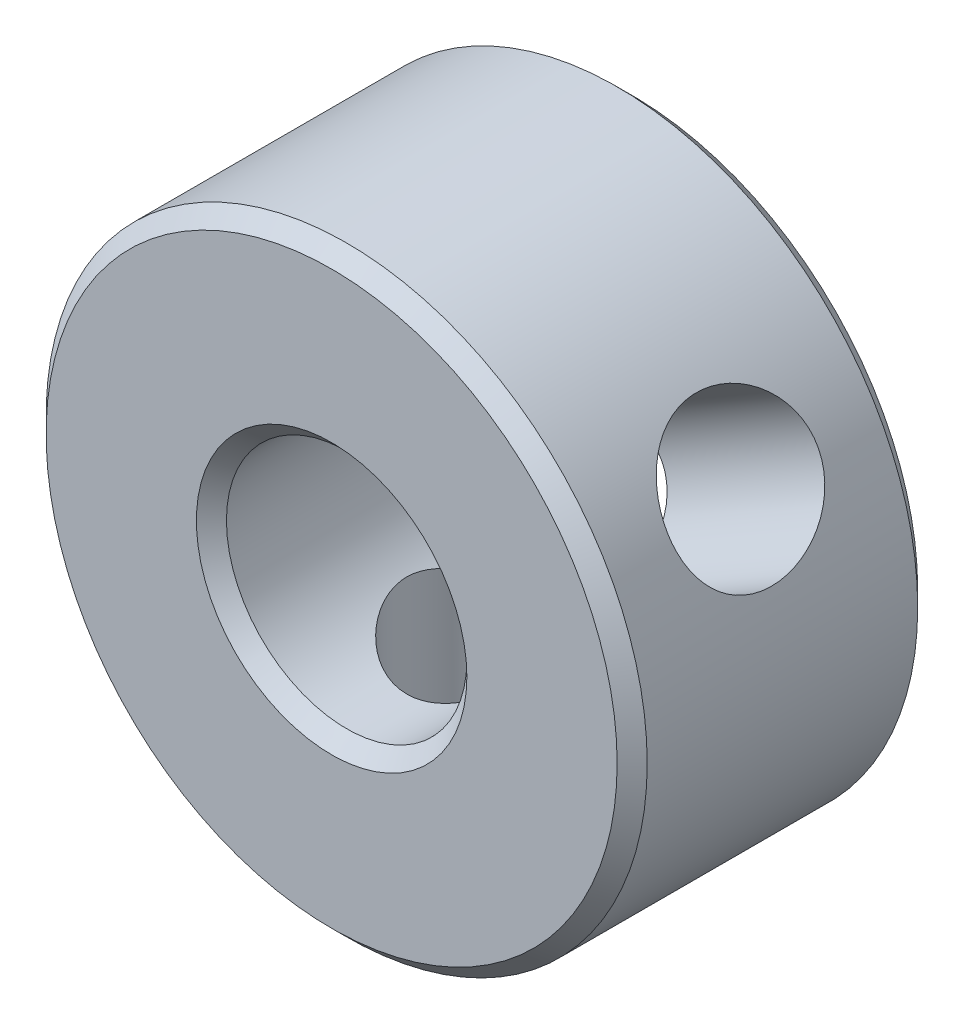
from build123d import *

# Parameters (mm, degrees)
SKETCH1_R          = 10
SKETCH1_R_2        = 4
BASE_EXTRUDE_DEPTH = 10
CHAMFER1_SIZE      = 0.5
SKETCH2_R          = 2.5
HOLE_DEPTH         = 18.320508076
ENDCHAMFER_SIZE    = 0.5
HOLEPAT_COUNT      = 2
HOLEPAT_ANGLE      = 120


with BuildPart() as part:
    # Sketch1 → Base-Extrude (new body)
    with BuildSketch(Plane.XY):
        Circle(SKETCH1_R)
        Circle(SKETCH1_R_2, mode=Mode.SUBTRACT)
    extrude(amount=-BASE_EXTRUDE_DEPTH)

    # Chamfer1
    chamfer1_edges = [part.edges().sort_by_distance(p)[0] for p in [
        (-10, 0, 0),
        (-10, 0, -10),
    ]]
    chamfer(chamfer1_edges, length=CHAMFER1_SIZE)

    # Sketch2 → Hole (cut, through all)
    with BuildSketch(Plane(origin=(0, 0, 0), x_dir=(1, 0, 0), z_dir=(0, 1, 0))):
        with Locations((0, 5)):
            Circle(SKETCH2_R)
    hole = extrude(amount=-HOLE_DEPTH, mode=Mode.SUBTRACT)

    # EndChamfer
    endchamfer_edges = [part.edges().sort_by_distance(p)[0] for p in [
        (-4, 0, -10),
        (-4, 0, 0),
    ]]
    chamfer(endchamfer_edges, length=ENDCHAMFER_SIZE)

    # HolePat: Hole ×2 about axis
    holepat_axis = Axis((0, 0, -10), (0, 0, 1))
    for i in range(1, HOLEPAT_COUNT):
        add(hole.rotate(holepat_axis, i * HOLEPAT_ANGLE / (HOLEPAT_COUNT - 1)), mode=Mode.SUBTRACT)


solid = part.part
